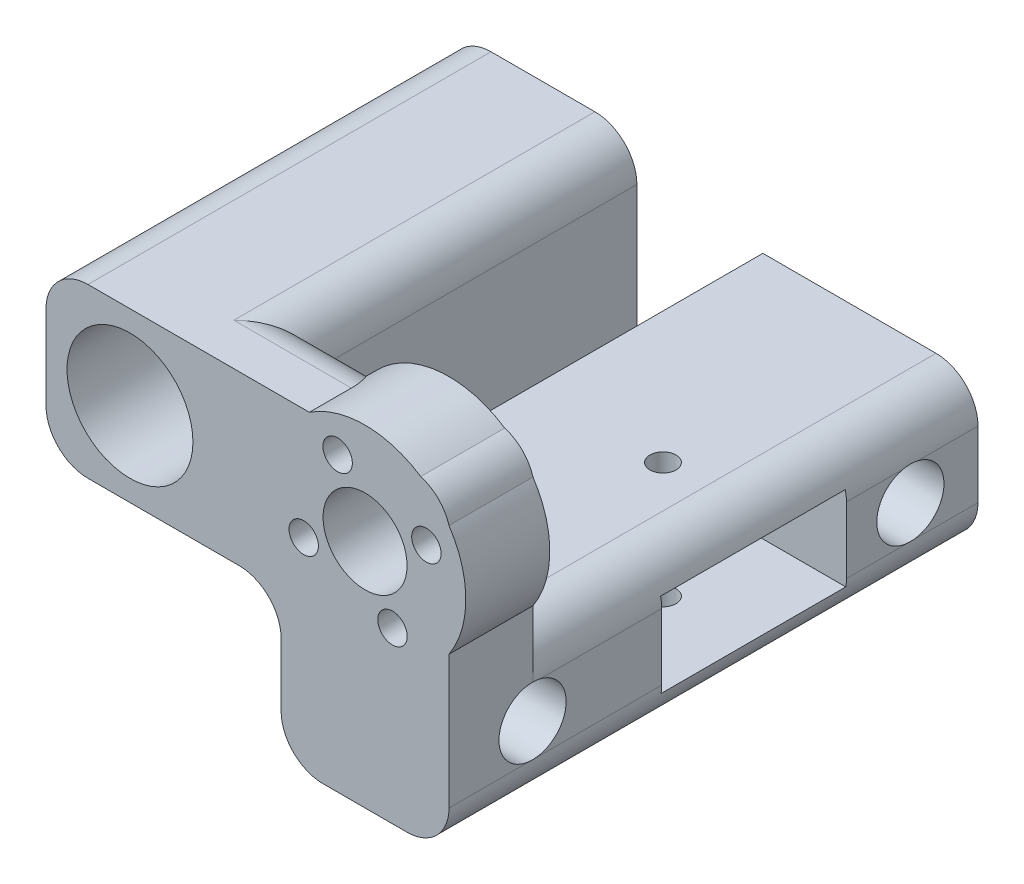
from build123d import *

# Parameters (mm, degrees)
EXTRUDE_1_DEPTH      = 40
SKETCH_2_R           = 7.5
SKETCH_2_R_2         = 4.9999999999999964
SKETCH_2_R_3         = 1.7500000000003626
SKETCH_2_R_4         = 1.7500000000004823
SKETCH_2_R_5         = 1.7500000000000004
SKETCH_2_R_6         = 1.7500000000001783
CUT_EXTRUDE_1_DEPTH  = 73.86746296427441
SKETCH_3_R           = 12.000000000543196
SKETCH_3_R_2         = 5.500000000543195
SKETCH_3_R_3         = 1.750000000000366
SKETCH_3_R_4         = 1.7500000000000004
SKETCH_3_R_5         = 1.7500000000001772
SKETCH_3_R_6         = 1.7500000000004823
EXTRUDE_3_DEPTH      = 10
SKETCH_4_W           = 25.62343390414386
SKETCH_4_H           = 19.600582626289906
CUT_EXTRUDE_2_DEPTH  = 38.00000000000001
FILLET_1_R           = 5
SKETCH_5_W           = 22
SKETCH_5_H           = 10
CUT_EXTRUDE_3_DEPTH  = 76.3412297087783
CUT_EXTRUDE_4_DEPTH  = 76.01757174727166
FILLET_2_R           = 5
EXTRUDE_4_DEPTH      = 23.000000000000007
FILLET_3_R           = 5
FILLET_4_R           = 5
SKETCH_8_R           = 1.5500000000000012
CUT_EXTRUDE_5_DEPTH  = 61.28699815842466
SKETCH_10_R          = 3.9999999999990434
SKETCH_10_R_2        = 1.5500000001559846
EXTRUDE_6_DEPTH      = 3
EXTRUDE_7_DEPTH      = 9.769249944
SKETCH_14_R          = 4.00000000000006
CUT_EXTRUDE_7_DEPTH  = 76.341229817754
EXTRUDE_8_DEPTH      = 15
SKETCH_18_R          = 3.999999999998341
CUT_EXTRUDE_10_DEPTH = 65.30672601787643
SKETCH_16_R          = 3.9999999998192686
CUT_EXTRUDE_8_DEPTH  = 76.341229817754


# Some blends are built 0.0001 mm under size
with BuildPart() as part:
    # 草图1 → 凸台-拉伸1 (new body)
    with BuildSketch(Plane(origin=(0, 0, 0), x_dir=(1, 0, 0), z_dir=(0, 1, 0))):
        Polygon((-10.50777202072539, 7.896373056994778), (37.49222797927462, 7.896373056994778), (37.492227979274624, -40.10362694300522), (-10.507772020725387, -40.10362694300522), align=None)
    extrude(amount=EXTRUDE_1_DEPTH)

    # 草图2 → 切除-拉伸1 (cut, through all)
    with BuildSketch(Plane.XY.offset(40.10362694300522)):
        with Locations((-0.5077720207253867, 30)):
            Circle(SKETCH_2_R)
        with Locations((27.492227979274613, 30)):
            Circle(SKETCH_2_R_2)
        with Locations((24.22666093119229, 37.303154924739225)):
            Circle(SKETCH_2_R_3)
        with Locations((34.79538290399571, 33.26556704810026)):
            Circle(SKETCH_2_R_4)
        with Locations((20.18907305455331, 26.7344329519358)):
            Circle(SKETCH_2_R_5)
        with Locations((30.75779502735674, 22.696845075296828)):
            Circle(SKETCH_2_R_6)
    extrude(amount=-CUT_EXTRUDE_1_DEPTH, mode=Mode.SUBTRACT)

    # 草图3 → 凸台-拉伸3 (add)
    with BuildSketch(Plane.XY.offset(40.10362694300522)):
        with Locations((27.492227979274418, 30.00000000001826)):
            Circle(SKETCH_3_R)
        with Locations((27.492227979274418, 30.00000000001826)):
            Circle(SKETCH_3_R_2, mode=Mode.SUBTRACT)
        with Locations((24.22666093119229, 37.30315492473925)):
            Circle(SKETCH_3_R_3, mode=Mode.SUBTRACT)
        with Locations((20.18907305455331, 26.734432951935826)):
            Circle(SKETCH_3_R_4, mode=Mode.SUBTRACT)
        with Locations((30.75779502735674, 22.696845075296856)):
            Circle(SKETCH_3_R_5, mode=Mode.SUBTRACT)
        with Locations((34.79538290399571, 33.26556704810028)):
            Circle(SKETCH_3_R_6, mode=Mode.SUBTRACT)
    extrude(amount=-EXTRUDE_3_DEPTH)

    # 草图4 → 切除-拉伸2 (cut)
    with BuildSketch(Plane(origin=(0, 0, -7.896373056994778), x_dir=(-1, 0, 0), z_dir=(0, 0, -1))):
        with Locations((-24.680511027202687, 30.199708686855047)):
            Rectangle(SKETCH_4_W, SKETCH_4_H)
    extrude(amount=-CUT_EXTRUDE_2_DEPTH, mode=Mode.SUBTRACT)

    # 圆角1
    # the kernel refuses this fillet: 5 mm, written as the material it takes off along each edge
    with BuildSketch(Plane(origin=(37.492227979274624, 40, 21.686750897283794), x_dir=(0, -1, 0), z_dir=(1.5e-16, 0, 1))) as fillet_1_piece_1:
        with BuildLine():
            CenterArc((4.792434215535032, -4.792434215539004), FILLET_1_R, 106.56702352707134, 56.8659529456977)
            Line((0, -3.366750418279196), (0, 0))
            Line((0, 0), (3.366750418288575, 0))
        make_face()
    extrude(amount=26.833752091442854, mode=Mode.SUBTRACT)

    # 草图5 → 切除-拉伸3 (cut, through all)
    with BuildSketch(Plane(origin=(37.49222797927462, 0, -5.42e-15), x_dir=(-1.4e-16, 0, -1), z_dir=(1, 0, -1.4e-16))):
        with Locations((-3.7696196746029966, 11.600566044145527)):
            Rectangle(SKETCH_5_W, SKETCH_5_H)
    extrude(amount=-CUT_EXTRUDE_3_DEPTH, mode=Mode.SUBTRACT)

    # 草图6 → 切除-拉伸4 (cut, through all)
    with BuildSketch(Plane.XY.offset(40.10362694300522)):
        Polygon((37.492227979274624, 0), (37.492227979274624, 2.5000000000259677), (17.492227979274624, 2.5000000000259655), (17.492227979274624, 20.000000000000004), (-10.507772020725385, 20), (-10.507772020725387, 0), align=None)
    extrude(amount=-CUT_EXTRUDE_4_DEPTH, mode=Mode.SUBTRACT)

    # 圆角2
    # the kernel refuses this fillet: 5 mm, written as the material it adds along each edge
    with BuildSketch(Plane(origin=(17.492227979274624, 20.000000000000004, 40.10362694300522), x_dir=(-1, 0, 0), z_dir=(0, 0, -1))) as fillet_2_piece_1_section:
        with BuildLine():
            CenterArc((FILLET_2_R, -FILLET_2_R), FILLET_2_R, 90, 90)
            Line((0, -FILLET_2_R), (0, 0))
            Line((0, 0), (FILLET_2_R, 0))
        make_face()
    fillet_2_piece_1 = extrude(amount=47.99999999999999, mode=Mode.PRIVATE)
    fillet_2_piece_1 = split(fillet_2_piece_1, bisect_by=Plane(origin=(17.49222797927462, 20.000000000000004, 14.769619674602993), z_dir=(1.4e-16, 0, 1)), keep=Keep.TOP, mode=Mode.PRIVATE)
    fillet_2_piece_1 = split(fillet_2_piece_1, bisect_by=Plane(origin=(17.492227979274624, 16.600566044145527, 40.10362694300522), z_dir=(0, 1, 0)), keep=Keep.TOP, mode=Mode.PRIVATE)
    add(fillet_2_piece_1)
    with BuildSketch(Plane(origin=(17.492227979274624, 20.000000000000004, 40.10362694300522), x_dir=(-1, 0, 0), z_dir=(0, 0, -1))) as fillet_2_piece_2_section:
        with BuildLine():
            CenterArc((FILLET_2_R, -FILLET_2_R), FILLET_2_R, 90, 90)
            Line((0, -FILLET_2_R), (0, 0))
            Line((0, 0), (FILLET_2_R, 0))
        make_face()
    fillet_2_piece_2 = extrude(amount=47.99999999999999, mode=Mode.PRIVATE)
    fillet_2_piece_2 = split(fillet_2_piece_2, bisect_by=Plane(origin=(17.49222797927462, 20.000000000000004, 14.769619674602993), z_dir=(1.4e-16, 0, 1)), keep=Keep.TOP, mode=Mode.PRIVATE)
    fillet_2_piece_2 = split(fillet_2_piece_2, bisect_by=Plane(origin=(17.492227979274624, 16.600566044145527, 40.10362694300522), z_dir=(0, -1, 0)), keep=Keep.TOP, mode=Mode.PRIVATE)
    add(fillet_2_piece_2)
    with BuildSketch(Plane(origin=(17.492227979274624, 20.000000000000004, 40.10362694300522), x_dir=(-1, 0, 0), z_dir=(0, 0, -1))) as fillet_2_piece_3_section:
        with BuildLine():
            CenterArc((FILLET_2_R, -FILLET_2_R), FILLET_2_R, 90, 90)
            Line((0, -FILLET_2_R), (0, 0))
            Line((0, 0), (FILLET_2_R, 0))
        make_face()
    fillet_2_piece_3 = extrude(amount=47.99999999999999, mode=Mode.PRIVATE)
    fillet_2_piece_3 = split(fillet_2_piece_3, bisect_by=Plane(origin=(17.49222797927462, 20.000000000000004, 14.769619674602993), z_dir=(-1.4e-16, 0, -1)), keep=Keep.TOP, mode=Mode.PRIVATE)
    fillet_2_piece_3 = split(fillet_2_piece_3, bisect_by=Plane(origin=(17.492227979274617, 20.000000000000004, -7.230380325397007), z_dir=(1.4e-16, 0, 1)), keep=Keep.TOP, mode=Mode.PRIVATE)
    fillet_2_piece_3 = split(fillet_2_piece_3, bisect_by=Plane(origin=(17.492227979274624, 16.600566044145527, 40.10362694300522), z_dir=(0, 1, 0)), keep=Keep.TOP, mode=Mode.PRIVATE)
    add(fillet_2_piece_3)
    with BuildSketch(Plane(origin=(17.492227979274624, 20.000000000000004, 40.10362694300522), x_dir=(-1, 0, 0), z_dir=(0, 0, -1))) as fillet_2_piece_4_section:
        with BuildLine():
            CenterArc((FILLET_2_R, -FILLET_2_R), FILLET_2_R, 90, 90)
            Line((0, -FILLET_2_R), (0, 0))
            Line((0, 0), (FILLET_2_R, 0))
        make_face()
    fillet_2_piece_4 = extrude(amount=47.99999999999999, mode=Mode.PRIVATE)
    fillet_2_piece_4 = split(fillet_2_piece_4, bisect_by=Plane(origin=(17.492227979274617, 20.000000000000004, -7.230380325397007), z_dir=(-1.4e-16, 0, -1)), keep=Keep.TOP, mode=Mode.PRIVATE)
    fillet_2_piece_4 = split(fillet_2_piece_4, bisect_by=Plane(origin=(17.492227979274624, 16.600566044145527, 40.10362694300522), z_dir=(0, 1, 0)), keep=Keep.TOP, mode=Mode.PRIVATE)
    add(fillet_2_piece_4)
    with BuildSketch(Plane(origin=(17.492227979274624, 20.000000000000004, 40.10362694300522), x_dir=(-1, 0, 0), z_dir=(0, 0, -1))) as fillet_2_piece_5_section:
        with BuildLine():
            CenterArc((FILLET_2_R, -FILLET_2_R), FILLET_2_R, 90, 90)
            Line((0, -FILLET_2_R), (0, 0))
            Line((0, 0), (FILLET_2_R, 0))
        make_face()
    fillet_2_piece_5 = extrude(amount=47.99999999999999, mode=Mode.PRIVATE)
    fillet_2_piece_5 = split(fillet_2_piece_5, bisect_by=Plane(origin=(17.492227979274617, 20.000000000000004, -7.230380325397007), z_dir=(-1.4e-16, 0, -1)), keep=Keep.TOP, mode=Mode.PRIVATE)
    fillet_2_piece_5 = split(fillet_2_piece_5, bisect_by=Plane(origin=(17.492227979274624, 16.600566044145527, 40.10362694300522), z_dir=(0, -1, 0)), keep=Keep.TOP, mode=Mode.PRIVATE)
    add(fillet_2_piece_5)
    # the kernel refuses this fillet: 5 mm, written as the material it takes off along each edge
    with BuildSketch(Plane(origin=(33.358978397553415, 40, 30.103626943005228), x_dir=(0, -1, -7.1e-16), z_dir=(-1, 0, 0))) as fillet_2_2_piece_1_section:
        with BuildLine():
            CenterArc((FILLET_2_R, FILLET_2_R), FILLET_2_R, 180.00000000000003, 90)
            Line((-3.55e-15, FILLET_2_R), (0, 0))
            Line((0, 0), (FILLET_2_R, 0))
        make_face()
    fillet_2_2_piece_1 = extrude(amount=21.49018432242266, mode=Mode.PRIVATE)
    fillet_2_2_piece_1 = fillet_2_2_piece_1 - Plane(origin=(27.492227979274418, 30.00000000001826, 30.103626943005228), x_dir=(1, 0, 0), z_dir=(0, 0, 1)) * Cylinder(12.000000000543196, 63, mode=Mode.PRIVATE)
    add(fillet_2_2_piece_1, mode=Mode.SUBTRACT)
    with BuildSketch(Plane(origin=(11.868794075130754, 40, -20.396373056994783), x_dir=(0, -1, 0), z_dir=(0, 0, 1))) as fillet_2_2_piece_2:
        with BuildLine():
            CenterArc((FILLET_2_R, -FILLET_2_R), FILLET_2_R, 90, 90)
            Line((0, -FILLET_2_R), (0, 0))
            Line((0, 0), (FILLET_2_R, 0))
        make_face()
    extrude(amount=50.500000000000014, mode=Mode.SUBTRACT)
    with BuildSketch(Plane(origin=(37.492227979274624, 2.5000000000259677, 52.603626943005224), x_dir=(-1, -1.8e-16, 0), z_dir=(0, 0, -1))) as fillet_2_2_piece_3:
        with BuildLine():
            CenterArc((FILLET_2_R, FILLET_2_R), FILLET_2_R, 180, 90)
            Line((-8.9e-16, FILLET_2_R), (0, 0))
            Line((0, 0), (FILLET_2_R, 0))
        make_face()
    extrude(amount=73, mode=Mode.SUBTRACT)
    with BuildSketch(Plane(origin=(-10.507772020725385, 40, 52.603626943005224), x_dir=(1, 0, -7e-17), z_dir=(-7e-17, 0, -1))) as fillet_2_2_piece_4:
        with BuildLine():
            CenterArc((FILLET_2_R, FILLET_2_R), FILLET_2_R, 180, 90)
            Line((-1.78e-15, FILLET_2_R), (0, 0))
            Line((0, 0), (FILLET_2_R, 0))
        make_face()
    extrude(amount=73, mode=Mode.SUBTRACT)
    with BuildSketch(Plane(origin=(-10.507772020725385, 20, 52.603626943005224), x_dir=(-7.1e-16, 1, 0), z_dir=(0, 0, -1))) as fillet_2_2_piece_5:
        with BuildLine():
            CenterArc((FILLET_2_R, FILLET_2_R), FILLET_2_R, 179.99999999999997, 90.00000000000006)
            Line((-3.55e-15, FILLET_2_R), (0, 0))
            Line((0, 0), (FILLET_2_R, 0))
        make_face()
    extrude(amount=73, mode=Mode.SUBTRACT)
    with BuildSketch(Plane(origin=(17.492227979274624, 2.5000000000259655, 52.603626943005224), x_dir=(0, 1, 0), z_dir=(0, 0, -1))) as fillet_2_2_piece_6:
        with BuildLine():
            CenterArc((FILLET_2_R, FILLET_2_R), FILLET_2_R, 180, 90)
            Line((1.33e-15, FILLET_2_R), (0, 0))
            Line((0, 0), (FILLET_2_R, 0))
        make_face()
    extrude(amount=73, mode=Mode.SUBTRACT)
    with BuildSketch(Plane(origin=(33.358978397553415, 40, 30.103626943005228), x_dir=(0, -1, -7.1e-16), z_dir=(-1, 0, 0))) as fillet_2_2_piece_7a_section:
        with BuildLine():
            CenterArc((FILLET_2_R, FILLET_2_R), FILLET_2_R, 180.00000000000003, 90)
            Line((-3.55e-15, FILLET_2_R), (0, 0))
            Line((0, 0), (FILLET_2_R, 0))
        make_face()
    fillet_2_2_piece_7a = extrude(amount=33.990184322422664, mode=Mode.PRIVATE)
    fillet_2_2_piece_7a = split(fillet_2_2_piece_7a, bisect_by=Plane(origin=(11.868794075130754, 40, 30.103626943005228), z_dir=(-1, 0, 0)), keep=Keep.TOP, mode=Mode.PRIVATE)
    with BuildSketch(Plane(origin=(11.868794075130754, 40, -20.396373056994783), x_dir=(0, -1, 0), z_dir=(0, 0, 1))) as fillet_2_2_piece_7b_section:
        with BuildLine():
            CenterArc((FILLET_2_R, -FILLET_2_R), FILLET_2_R, 90, 90)
            Line((0, -FILLET_2_R), (0, 0))
            Line((0, 0), (FILLET_2_R, 0))
        make_face()
    fillet_2_2_piece_7b = extrude(amount=63.000000000000014, mode=Mode.PRIVATE)
    fillet_2_2_piece_7b = split(fillet_2_2_piece_7b, bisect_by=Plane(origin=(11.868794075130754, 40, 30.10362694300523), z_dir=(0, 0, 1)), keep=Keep.TOP, mode=Mode.PRIVATE)
    fillet_2_2_piece_7 = fillet_2_2_piece_7a & fillet_2_2_piece_7b
    add(fillet_2_2_piece_7, mode=Mode.SUBTRACT)

    # 草图7 → 凸台-拉伸4 (add)
    with BuildSketch(Plane.ZY.offset(-17.492227979274624)):
        Polygon((-7.896373056994782, 20), (-7.896373056994782, 2.500000000025966), (1.872876886886156, 2.5000000000259672), (1.8728768868861567, 20), align=None)
    extrude(amount=EXTRUDE_4_DEPTH)

    # 圆角3
    fillet_3_edges = [part.edges().sort_by_distance(p)[0] for p in [
        (17.492227979274624, 2.500000000025967, -3.011748085054313),
        (-5.507772020725, 20, -3.0117480850543075),
        (-5.507772020725383, 2.500000000025967, -3.011748085054313),
    ]]
    fillet(fillet_3_edges, radius=FILLET_3_R - 0.0001)  # a hair under: the kernel refuses the full size

    # 圆角4
    # the kernel refuses this fillet: 5 mm, written as the material it takes off along each edge
    with BuildSketch(Plane(origin=(37.49222797927462, 20.399417373710094, -20.396373056994783), x_dir=(-1, 0, 0), z_dir=(0, 0, 1))) as fillet_4_piece_1:
        with BuildLine():
            CenterArc((FILLET_4_R, FILLET_4_R), FILLET_4_R, 180, 90)
            Line((0, FILLET_4_R), (0, 0))
            Line((0, 0), (FILLET_4_R, 0))
        make_face()
    extrude(amount=50.500000000000014, mode=Mode.SUBTRACT)

    # 草图8 → 切除-拉伸5 (cut, through all)
    with BuildSketch(Plane(origin=(0, 20.399417373710094, 0), x_dir=(1, 0, 0), z_dir=(0, 1, 0))):
        with Locations(Location((27.492227980095734, -4.622370103598284, 0), (0, 0, 270))):
            Circle(SKETCH_8_R)
    extrude(amount=-CUT_EXTRUDE_5_DEPTH, mode=Mode.SUBTRACT)

    # 草图10 → 凸台-拉伸6 (add)
    with BuildSketch(Plane.XZ.offset(-2.5000000000259637)):
        with Locations(Location((27.492227980095738, 4.622370103598284, 0), (0, 0, 180))):
            Circle(SKETCH_10_R)
        with Locations(Location((27.492227980095738, 4.622370103598284, 0), (0, 0, 90))):
            Circle(SKETCH_10_R_2, mode=Mode.SUBTRACT)
    extrude(amount=EXTRUDE_6_DEPTH)

    # 草图11 → 凸台-拉伸7 (add)
    with BuildSketch(Plane.XY.offset(1.872876886886156)):
        Polygon((12.492227979274622, 2.5000000000259672), (22.492227979274624, 2.500000000025966), (17.49222797927462, 7.500000000025967), align=None)
    extrude(amount=-EXTRUDE_7_DEPTH)

    # 草图14 → 切除-拉伸7 (cut, through all)
    with BuildSketch(Plane(origin=(37.49222797927462, 0, -5.42e-15), x_dir=(-1.4e-16, 0, -1), z_dir=(1, 0, -1.4e-16))):
        with Locations(Location((-30.15759147547415, 11.50000000055565, 0), (0, 0, 270))):
            Circle(SKETCH_14_R)
    extrude(amount=-CUT_EXTRUDE_7_DEPTH, mode=Mode.SUBTRACT)

    # 草图17 → 凸台-拉伸8 (add)
    with BuildSketch(Plane(origin=(0, 0, -7.896373056994778), x_dir=(-1, 0, 0), z_dir=(0, 0, -1))):
        with BuildLine():
            Line((-11.868794075130754, 20.399417373710094), (-11.868794075130754, 2.500000000025967))
            Line((-11.868794075130754, 2.500000000025967), (-32.49222797927462, 2.5000000000259672))
            ThreePointArc((-32.49222797927462, 2.5000000000259672), (-36.027761885207354, 3.964466094093229), (-37.49222797927462, 7.500000000025965))
            Line((-37.49222797927462, 7.500000000025965), (-37.49222797927462, 15.399417373710092))
            ThreePointArc((-37.49222797927462, 15.399417373710092), (-36.027761885207354, 18.93495127964283), (-32.49222797927462, 20.399417373710094))
            Line((-32.49222797927462, 20.399417373710094), (-11.868794075130754, 20.399417373710094))
        make_face()
    extrude(amount=EXTRUDE_8_DEPTH)

    # 草图18 → 切除-拉伸10 (cut, through all)
    with BuildSketch(Plane.ZY.offset(-11.868794075130754)):
        with Locations((-14.842408524515182, 11.500000000561617)):
            Circle(SKETCH_18_R)
    extrude(amount=-CUT_EXTRUDE_10_DEPTH, mode=Mode.SUBTRACT)

    # 草图16 → 切除-拉伸8 (cut, through all)
    with BuildSketch(Plane(origin=(37.49222797927462, 0, -5.42e-15), x_dir=(-1.4e-16, 0, -1), z_dir=(1, 0, -1.4e-16))):
        with Locations(Location((14.84240852451923, 11.5000000000062, 0), (0, 0, 179.999999992))):
            Circle(SKETCH_16_R)
    extrude(amount=-CUT_EXTRUDE_8_DEPTH, mode=Mode.SUBTRACT)


solid = part.part
